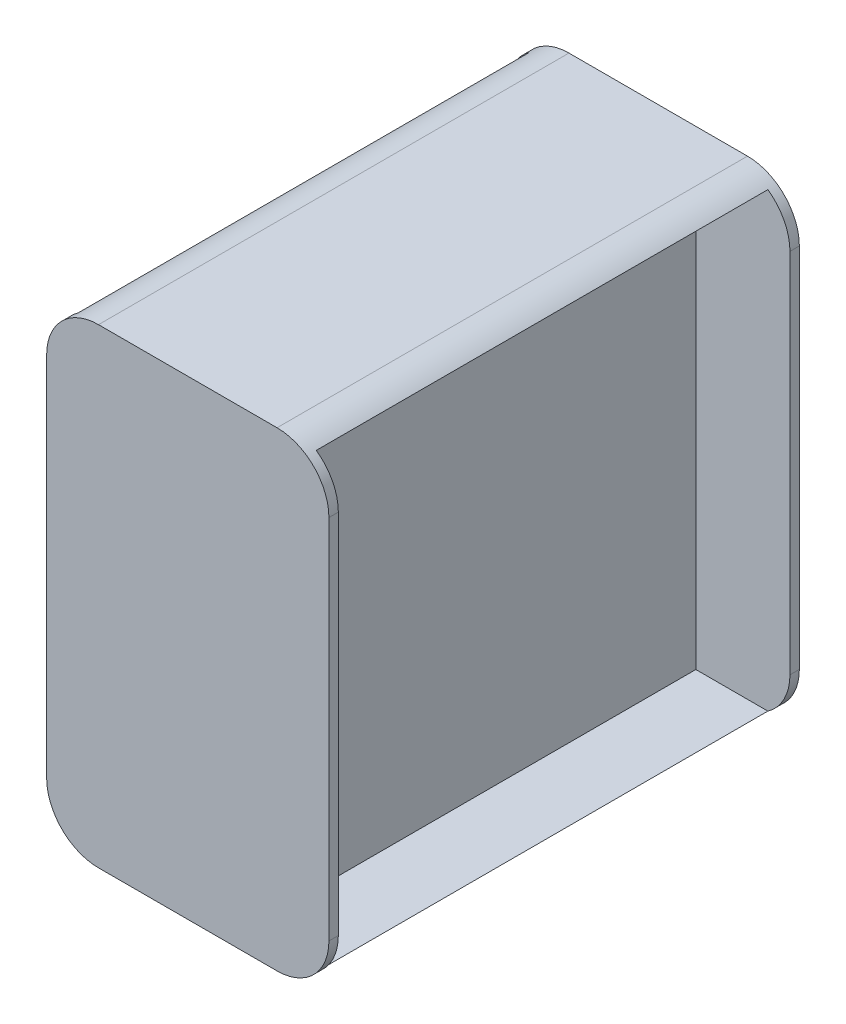
from build123d import *

# Parameters (mm, degrees)
SKETCH1_W           = 38.1
SKETCH1_H           = 63.5
BOSS_EXTRUDE1_DEPTH = 63.5
SKETCH2_W           = 60.96
SKETCH2_H           = 60.96
CUT_EXTRUDE1_DEPTH  = 12.7
LPATTERN1_COUNT     = 2
LPATTERN1_PITCH     = 25.4
FILLET1_R           = 7
FILLET2_R           = 7


with BuildPart() as part:
    # Sketch1 → Boss-Extrude1 (new body)
    with BuildSketch(Plane(origin=(0, 0, 0), x_dir=(1, 0, 0), z_dir=(0, 1, 0))):
        Rectangle(SKETCH1_W, SKETCH1_H)
    extrude(amount=BOSS_EXTRUDE1_DEPTH)

    # Sketch2 → Cut-Extrude1 (cut)
    with BuildSketch(Plane(origin=(19.05, 0, 0), x_dir=(0, 0, -1), z_dir=(1, 0, 0))):
        with Locations((0, 31.75)):
            Rectangle(SKETCH2_W, SKETCH2_H)
    cut_extrude1 = extrude(amount=-CUT_EXTRUDE1_DEPTH, mode=Mode.SUBTRACT)

    # LPattern1: Cut-Extrude1 ×2
    with Locations(*[(-i * LPATTERN1_PITCH, 0, 0) for i in range(1, LPATTERN1_COUNT)]):
        add(cut_extrude1, mode=Mode.SUBTRACT)

    # Fillet1
    # the kernel refuses this fillet: 7 mm, written as the material it takes off along each edge
    with BuildSketch(Plane(origin=(19.05, 63.5, -49.25), x_dir=(0, -1, 0), z_dir=(0, 0, 1)), Plane(origin=(-19.05, 63.5, 49.25), x_dir=(0, -1, 0), z_dir=(0, 0, -1))) as fillet1_piece_1:
        with BuildLine():
            CenterArc((FILLET1_R, -FILLET1_R), FILLET1_R, 90, 90)
            Line((0, -FILLET1_R), (0, 0))
            Line((0, 0), (FILLET1_R, 0))
        make_face()
    extrude(amount=98.5, mode=Mode.SUBTRACT)

    # Fillet2
    # the kernel refuses this fillet: 7 mm, written as the material it takes off along each edge
    with BuildSketch(Plane(origin=(-19.05, 0, 49.25), x_dir=(1, 0, 0), z_dir=(0, 0, -1)), Plane(origin=(19.05, 0, -49.25), x_dir=(-1, 0, 0), z_dir=(0, 0, 1))) as fillet2_piece_1:
        with BuildLine():
            CenterArc((FILLET2_R, -FILLET2_R), FILLET2_R, 90, 90)
            Line((0, -FILLET2_R), (0, 0))
            Line((0, 0), (FILLET2_R, 0))
        make_face()
    extrude(amount=98.5, mode=Mode.SUBTRACT)


solid = part.part
